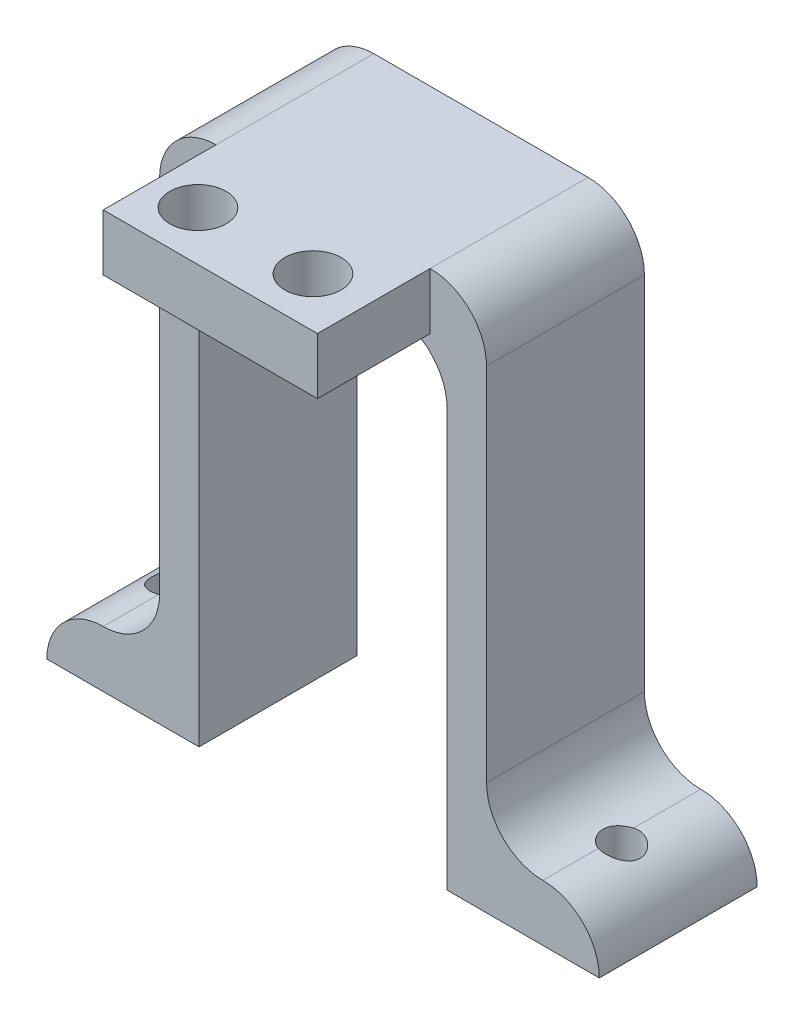
from build123d import *

# Parameters (mm, degrees)
BOSS_EXTRUDE1_DEPTH     = 14
FILLET1_R               = 5
FILLET2_R               = 5
CUT_EXTRUDE3_DEPTH      = 10
CUT_EXTRUDE3_DEPTH_BACK = 10
SKETCH2_R               = 1.636049027
SKETCH4_W               = 19
SKETCH4_H               = 5
BOSS_EXTRUDE2_DEPTH     = 10
SKETCH5_R               = 2.5
CUT_EXTRUDE4_DEPTH      = 10


with BuildPart() as part:
    # Sketch1 → Boss-Extrude1 (new body)
    with BuildSketch(Plane.XY):
        Polygon((-24.5, 0), (-24.5, 5), (-14.5, 5), (-14.5, 47), (14.5, 47), (14.5, 5), (24.5, 5), (24.5, 0), (11, 0), (11, 42), (-11, 42), (-11, 0), align=None)
    extrude(amount=BOSS_EXTRUDE1_DEPTH)

    # Fillet1
    fillet1_edges = [part.edges().sort_by_distance(p)[0] for p in [
        (-14.5, 47, 7),
        (14.5, 47, 7),
        (24.5, 5, 7),
        (-24.5, 5, 7),
        (14.5, 5, 7),
        (-14.5, 5, 7),
    ]]
    fillet(fillet1_edges, radius=FILLET1_R - 0.0001)  # a hair under: the kernel refuses the full size

    # Fillet2
    fillet2_edges = [part.edges().sort_by_distance(p)[0] for p in [
        (11, 42, 7),
        (-11, 42, 7),
    ]]
    fillet(fillet2_edges, radius=FILLET2_R)

    # Sketch2 → Cut-Extrude3 (cut, two sides: drawn at the far end of the back side and taken through both)
    with BuildSketch(Plane(origin=(0, 0, 0), x_dir=(1, 0, 0), z_dir=(0, 1, 0)).offset(-CUT_EXTRUDE3_DEPTH_BACK)):
        with Locations(Location((-20, -7.523321805, 0), (0, 0, 72.20487372))):
            Circle(SKETCH2_R)
        with Locations(Location((20, -7.523321805, 0), (0, 0, 107.795126278))):
            Circle(SKETCH2_R)
    extrude(amount=CUT_EXTRUDE3_DEPTH + CUT_EXTRUDE3_DEPTH_BACK, mode=Mode.SUBTRACT)

    # Sketch4 → Boss-Extrude2 (add)
    with BuildSketch(Plane.XY.offset(14)):
        with Locations((0, 44.5)):
            Rectangle(SKETCH4_W, SKETCH4_H)
    extrude(amount=BOSS_EXTRUDE2_DEPTH)

    # Sketch5 → Cut-Extrude4 (cut)
    with BuildSketch(Plane(origin=(0, 47, 0), x_dir=(1, 0, 0), z_dir=(0, 1, 0))):
        with Locations(Location((4.70575, -19.60149527, 0), (0, 0, 270))):
            Circle(SKETCH5_R)
        with Locations(Location((-5.477408827, -19.618067384, 0), (0, 0, 270))):
            Circle(SKETCH5_R)
    extrude(amount=-CUT_EXTRUDE4_DEPTH, mode=Mode.SUBTRACT)


solid = part.part
